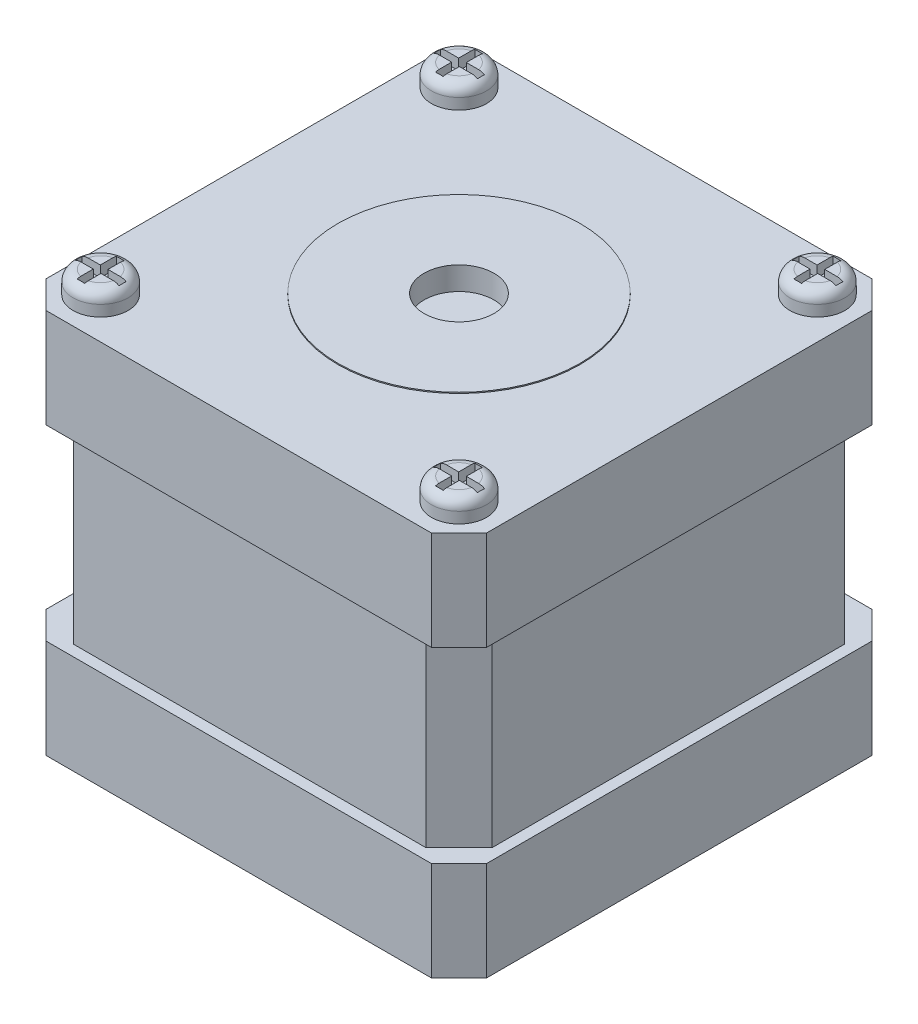
from build123d import *

# Parameters (mm, degrees)
CROQUIS1_W              = 40
CROQUIS1_H              = 40
SALIENTE_EXTRUIR1_DEPTH = 9
CROQUIS2_W              = 38
CROQUIS2_H              = 38
SALIENTE_EXTRUIR2_DEPTH = 17
CROQUIS3_W              = 40
CROQUIS3_H              = 40
SALIENTE_EXTRUIR3_DEPTH = 9
CHAFL_N1_SIZE           = 3
CHAFL_N2_SIZE           = 2.5
CROQUIS4_R              = 3.175
CORTAR_EXTRUIR1_DEPTH   = 2
SALIENTE_EXTRUIR4_START = 0.1
CROQUIS5_R              = 11
CROQUIS5_R_2            = 3.175
SALIENTE_EXTRUIR4_DEPTH = 0.1
CROQUIS6_R              = 2.5
SALIENTE_EXTRUIR5_DEPTH = 2
CORTAR_EXTRUIR2_DEPTH   = 1
REDONDEO1_R             = 1


with BuildPart() as part:
    # Croquis1 → Saliente-Extruir1 (new body)
    with BuildSketch(Plane(origin=(0, 0, 0), x_dir=(1, 0, 0), z_dir=(0, 1, 0))):
        Rectangle(CROQUIS1_W, CROQUIS1_H)
    extrude(amount=SALIENTE_EXTRUIR1_DEPTH)

    # Croquis2 → Saliente-Extruir2 (add)
    with BuildSketch(Plane(origin=(0, 9, 0), x_dir=(1, 0, 0), z_dir=(0, 1, 0))):
        Rectangle(CROQUIS2_W, CROQUIS2_H)
    extrude(amount=SALIENTE_EXTRUIR2_DEPTH)

    # Croquis3 → Saliente-Extruir3 (add)
    with BuildSketch(Plane(origin=(0, 26, 0), x_dir=(1, 0, 0), z_dir=(0, 1, 0))):
        Rectangle(CROQUIS3_W, CROQUIS3_H)
    extrude(amount=SALIENTE_EXTRUIR3_DEPTH)

    # Chaflán1
    chafl_n1_edges = [part.edges().sort_by_distance(p)[0] for p in [
        (-19, 17.5, -19),
        (-19, 17.5, 19),
        (19, 17.5, 19),
        (19, 17.5, -19),
    ]]
    chamfer(chafl_n1_edges, length=CHAFL_N1_SIZE)

    # Chaflán2
    chafl_n2_edges = [part.edges().sort_by_distance(p)[0] for p in [
        (-20, 30.5, -20),
        (-20, 30.5, 20),
        (20, 30.5, 20),
        (20, 30.5, -20),
        (20, 4.5, 20),
        (-20, 4.5, 20),
        (-20, 4.5, -20),
        (20, 4.5, -20),
    ]]
    chamfer(chafl_n2_edges, length=CHAFL_N2_SIZE)

    # Croquis4 → Cortar-Extruir1 (cut)
    with BuildSketch(Plane(origin=(0, 35, 0), x_dir=(1, 0, 0), z_dir=(0, 1, 0))):
        with Locations(Location((0, 0, 0), (0, 0, 270))):
            Circle(CROQUIS4_R)
    extrude(amount=-CORTAR_EXTRUIR1_DEPTH, mode=Mode.SUBTRACT)

    # Croquis5 → Saliente-Extruir4 (add)
    with BuildSketch(Plane(origin=(0, 35, 0), x_dir=(1, 0, 0), z_dir=(0, 1, 0)).offset(SALIENTE_EXTRUIR4_START)):
        with Locations(Location((0, 0, 0), (0, 0, 90))):
            Circle(CROQUIS5_R)
        with Locations(Location((0, 0, 0), (0, 0, 270))):
            Circle(CROQUIS5_R_2, mode=Mode.SUBTRACT)
    extrude(amount=-SALIENTE_EXTRUIR4_DEPTH)

    # Croquis6 → Saliente-Extruir5 (add)
    with BuildSketch(Plane(origin=(0, 35, 0), x_dir=(1, 0, 0), z_dir=(0, 1, 0))):
        with Locations(Location((-16.275126266, -16.275126266, 0), (0, 0, 90))):
            Circle(CROQUIS6_R)
        with Locations(Location((-16.275126266, 16.275126266, 0), (0, 0, 90))):
            Circle(CROQUIS6_R)
        with Locations(Location((16.275126266, 16.275126266, 0), (0, 0, 90))):
            Circle(CROQUIS6_R)
        with Locations(Location((16.275126266, -16.275126266, 0), (0, 0, 90))):
            Circle(CROQUIS6_R)
    extrude(amount=SALIENTE_EXTRUIR5_DEPTH)

    # Croquis7 → Cortar-Extruir2 (cut)
    with BuildSketch(Plane(origin=(0, 37, 0), x_dir=(1, 0, 0), z_dir=(0, 1, 0))):
        Polygon((-15.926951302, -15.956416982), (-15.926951302, -14.490184749), (-16.62330123, -14.490184749), (-16.62330123, -15.956416982), (-18.27030182, -15.956416982), (-18.27030182, -16.593835549), (-16.62330123, -16.593835549), (-16.62330123, -18.060067782), (-15.926951302, -18.060067782), (-15.926951302, -16.593835549), (-14.279950711, -16.593835549), (-14.279950711, -15.956416982), align=None)
        Polygon((-16.62330123, 15.956416982), (-18.27030182, 15.956416982), (-18.27030182, 16.593835549), (-16.62330123, 16.593835549), (-16.62330123, 18.060067782), (-15.926951302, 18.060067782), (-15.926951302, 16.593835549), (-14.279950711, 16.593835549), (-14.279950711, 15.956416982), (-15.926951302, 15.956416982), (-15.926951302, 14.490184749), (-16.62330123, 14.490184749), align=None)
        Polygon((15.926951302, 15.956416982), (15.926951302, 14.490184749), (16.62330123, 14.490184749), (16.62330123, 15.956416982), (18.27030182, 15.956416982), (18.27030182, 16.593835549), (16.62330123, 16.593835549), (16.62330123, 18.060067782), (15.926951302, 18.060067782), (15.926951302, 16.593835549), (14.279950711, 16.593835549), (14.279950711, 15.956416982), align=None)
        Polygon((16.62330123, -15.956416982), (18.27030182, -15.956416982), (18.27030182, -16.593835549), (16.62330123, -16.593835549), (16.62330123, -18.060067782), (15.926951302, -18.060067782), (15.926951302, -16.593835549), (14.279950711, -16.593835549), (14.279950711, -15.956416982), (15.926951302, -15.956416982), (15.926951302, -14.490184749), (16.62330123, -14.490184749), align=None)
    extrude(amount=-CORTAR_EXTRUIR2_DEPTH, mode=Mode.SUBTRACT)

    # Redondeo1
    # the kernel refuses this fillet: 1 mm, written as the material it takes off along each edge
    with BuildSketch(Plane(origin=(16.275126266, 37, -16.275126266), x_dir=(0, 0, -1), z_dir=(1, 0, 0))) as redondeo1_piece_1:
        with BuildLine():
            CenterArc((2.5 - REDONDEO1_R, -REDONDEO1_R), REDONDEO1_R, 0, 90)
            Line((2.5 - REDONDEO1_R, 0), (2.5, 0))
            Line((2.5, 0), (2.5, -REDONDEO1_R))
        make_face()
    revolve(axis=Axis((16.275126266, 37, -16.275126266), (0, 1, 0)), mode=Mode.SUBTRACT)
    with BuildSketch(Plane(origin=(16.275126266, 37, 16.275126266), x_dir=(0, 0, -1), z_dir=(1, 0, 0))) as redondeo1_piece_2:
        with BuildLine():
            CenterArc((2.5 - REDONDEO1_R, -REDONDEO1_R), REDONDEO1_R, 0, 90)
            Line((2.5 - REDONDEO1_R, 0), (2.5, 0))
            Line((2.5, 0), (2.5, -REDONDEO1_R))
        make_face()
    revolve(axis=Axis((16.275126266, 37, 16.275126266), (0, 1, 0)), mode=Mode.SUBTRACT)
    with BuildSketch(Plane(origin=(-16.275126266, 37, -16.275126266), x_dir=(0, 0, -1), z_dir=(1, 0, 0))) as redondeo1_piece_3:
        with BuildLine():
            CenterArc((2.5 - REDONDEO1_R, -REDONDEO1_R), REDONDEO1_R, 0, 90)
            Line((2.5 - REDONDEO1_R, 0), (2.5, 0))
            Line((2.5, 0), (2.5, -REDONDEO1_R))
        make_face()
    revolve(axis=Axis((-16.275126266, 37, -16.275126266), (0, 1, 0)), mode=Mode.SUBTRACT)
    with BuildSketch(Plane(origin=(-16.275126266, 37, 16.275126266), x_dir=(0, 0, -1), z_dir=(1, 0, 0))) as redondeo1_piece_4:
        with BuildLine():
            CenterArc((2.5 - REDONDEO1_R, -REDONDEO1_R), REDONDEO1_R, 0, 90)
            Line((2.5 - REDONDEO1_R, 0), (2.5, 0))
            Line((2.5, 0), (2.5, -REDONDEO1_R))
        make_face()
    revolve(axis=Axis((-16.275126266, 37, 16.275126266), (0, 1, 0)), mode=Mode.SUBTRACT)


solid = part.part
